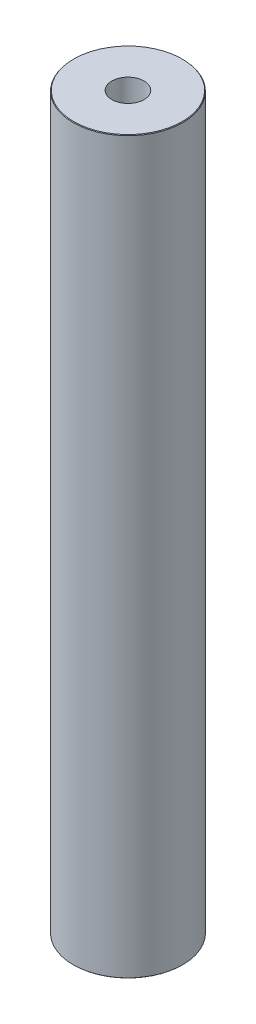
from build123d import *
from OCP.BRepFilletAPI import BRepFilletAPI_MakeChamfer

# Parameters (mm, degrees)
SKETCH1_R           = 45
BOSS_EXTRUDE1_DEPTH = 600
SKETCH2_R           = 13.252143046
CUT_EXTRUDE1_DEPTH  = 604.365560834
CHAMFER1_SIZE       = 0.501831054
CHAMFER1_SIZE2      = 0.44372118


with BuildPart() as part:
    # Sketch1 → Boss-Extrude1 (new body)
    with BuildSketch(Plane(origin=(0, 0, 0), x_dir=(1, 0, 0), z_dir=(0, 1, 0))):
        Circle(SKETCH1_R)
    extrude(amount=BOSS_EXTRUDE1_DEPTH)

    # Sketch2 → Cut-Extrude1 (cut, through all)
    with BuildSketch(Plane(origin=(0, 0, 0), x_dir=(1, 0, 0), z_dir=(0, 1, 0))):
        Circle(SKETCH2_R)
    extrude(amount=CUT_EXTRUDE1_DEPTH, mode=Mode.SUBTRACT)

    # Chamfer1: one chamfer whose edges measure the first distance from different faces: ONE call of the kernel's chamfer builder (chamfer() names one face for all edges)
    chamfer1_edges_1 = [part.edges().sort_by_distance(p)[0] for p in [
        (-45, 600, 0),
    ]]
    chamfer1_side_1 = [part.faces().sort_by_distance(p)[0] for p in [
        (-45, 300, 0),
    ]]
    chamfer1_edges_2 = [part.edges().sort_by_distance(p)[0] for p in [
        (-45, 0, 0),
    ]]
    chamfer1_side_2 = [part.faces().sort_by_distance(p)[0] for p in [
        (-43.727207794, 0, 0),
    ]]
    chamfer1 = BRepFilletAPI_MakeChamfer(part.part.solid().wrapped)
    for e in chamfer1_edges_1:
        chamfer1.Add(CHAMFER1_SIZE, CHAMFER1_SIZE2, e.wrapped, chamfer1_side_1[0].wrapped)  # the first distance lies on this face
    for e in chamfer1_edges_2:
        chamfer1.Add(CHAMFER1_SIZE, CHAMFER1_SIZE2, e.wrapped, chamfer1_side_2[0].wrapped)  # the first distance lies on this face
    add(Compound.cast(chamfer1.Shape()), mode=Mode.REPLACE)


solid = part.part
